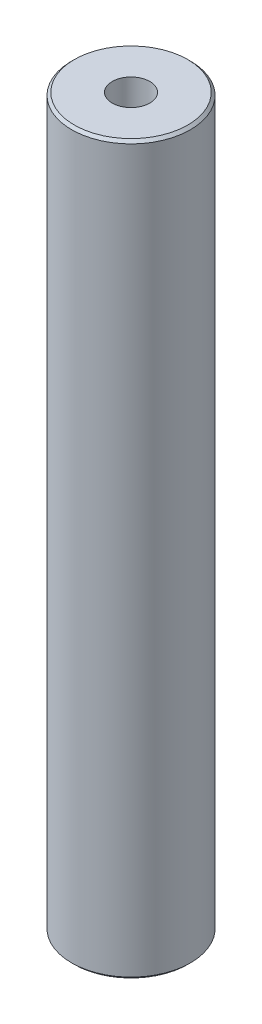
from build123d import *

# Parameters (mm, degrees)
SKETCH1_R           = 20
BOSS_EXTRUDE1_DEPTH = 244.581951853
SKETCH2_R           = 6.315232817
CUT_EXTRUDE1_DEPTH  = 247.21196391
CHAMFER1_SIZE       = 0.907069065


with BuildPart() as part:
    # Sketch1 → Boss-Extrude1 (new body)
    with BuildSketch(Plane(origin=(0, 0, 0), x_dir=(1, 0, 0), z_dir=(0, 1, 0))):
        Circle(SKETCH1_R)
    extrude(amount=BOSS_EXTRUDE1_DEPTH)

    # Sketch2 → Cut-Extrude1 (cut, through all)
    with BuildSketch(Plane(origin=(0, 0, 0), x_dir=(1, 0, 0), z_dir=(0, 1, 0))):
        Circle(SKETCH2_R)
    extrude(amount=CUT_EXTRUDE1_DEPTH, mode=Mode.SUBTRACT)

    # Chamfer1
    chamfer1_edges = [part.edges().sort_by_distance(p)[0] for p in [
        (-20, 244.581951853, 0),
        (-20, 0, 0),
    ]]
    chamfer(chamfer1_edges, length=CHAMFER1_SIZE)


solid = part.part
